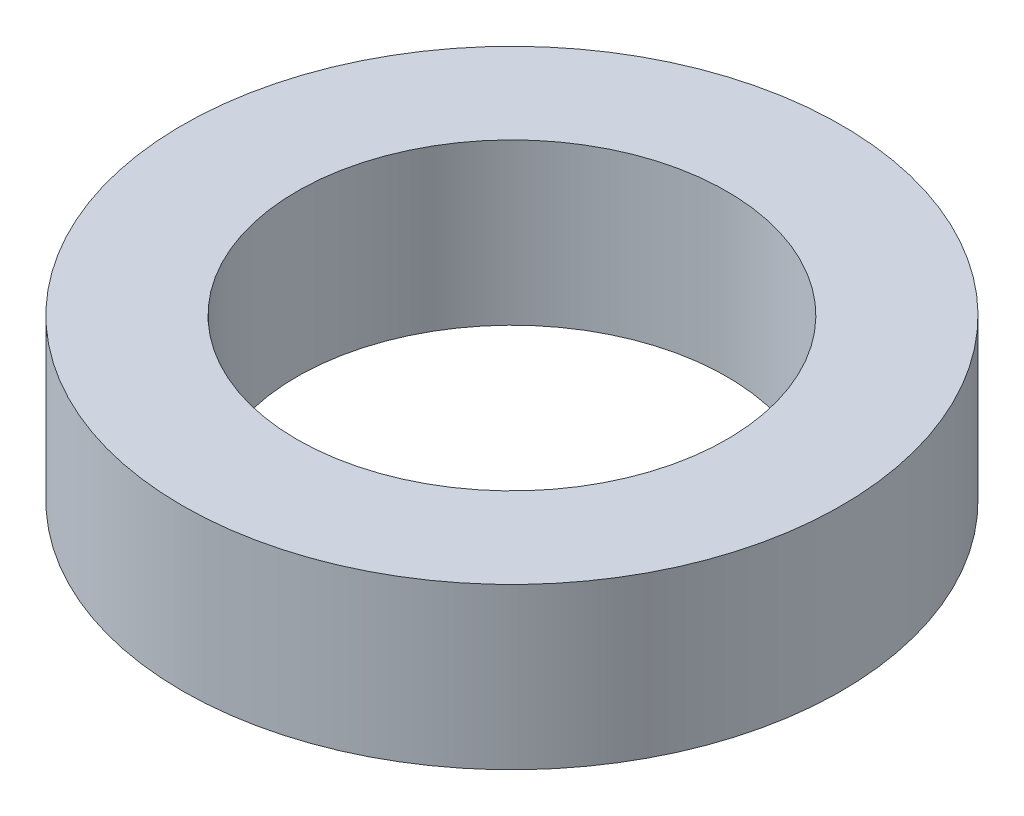
from build123d import *

# Parameters (mm, degrees)
SKETCH1_R           = 57.5
BOSS_EXTRUDE1_DEPTH = 28
SKETCH2_R           = 37.5
CUT_EXTRUDE1_DEPTH  = 87.002906928


with BuildPart() as part:
    # Sketch1 → Boss-Extrude1 (new body)
    with BuildSketch(Plane(origin=(0, 0, 0), x_dir=(1, 0, 0), z_dir=(0, 1, 0))):
        Circle(SKETCH1_R)
    extrude(amount=BOSS_EXTRUDE1_DEPTH)

    # Sketch2 → Cut-Extrude1 (cut, through all)
    with BuildSketch(Plane(origin=(0, 0, 0), x_dir=(1, 0, 0), z_dir=(0, 1, 0))):
        Circle(SKETCH2_R)
    extrude(amount=CUT_EXTRUDE1_DEPTH, mode=Mode.SUBTRACT)


solid = part.part
